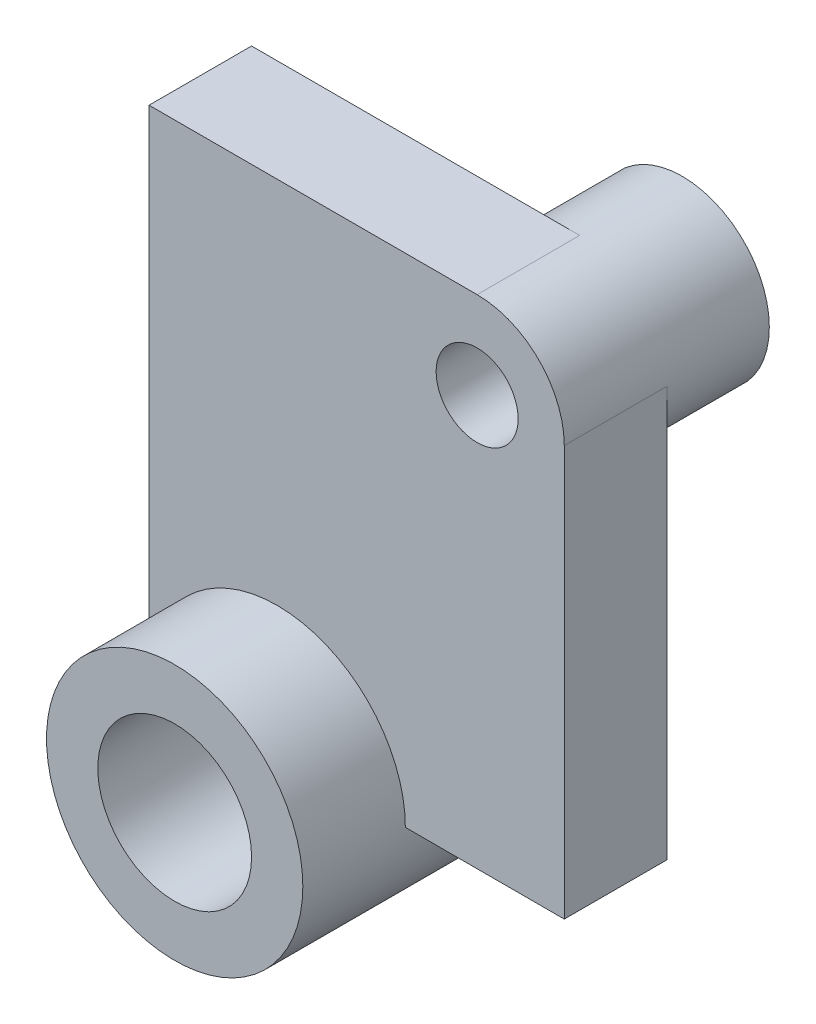
from build123d import *
from build123d.topology import SkipClean

# Parameters (mm, degrees)
SKETCH_1_R          = 4
EXTRUDE_1_DEPTH     = 10
CUT_EXTRUDE_1_DEPTH = 63.713634881
SKETCH_3_R          = 12.5
EXTRUDE_2_DEPTH     = 10
CUT_EXTRUDE_2_REACH = 64.292
SKETCH_4_R          = 7.5
EXTRUDE_START       = 10
SKETCH_5_R          = 12.5
SKETCH_5_R_2        = 7.5
EXTRUDE_3_DEPTH     = 10
SKETCH_6_R          = 8.5
SKETCH_6_R_2        = 4
EXTRUDE_4_DEPTH     = 10
EXTRUDE_START_2     = -10
EXTRUDE_5_DEPTH     = 10
CUT_EXTRUDE_3_DEPTH = 65.654852873


with BuildPart() as part:
    # Эскиз1 → Бобышка-Вытянуть1 (new body)
    with BuildSketch(Plane.XY):
        with BuildLine():
            Line((13, -15), (8.188495856, 2.280029742))
            ThreePointArc((8.188495856, 2.280029742), (2.584908604, 8.097422276), (-5.352868863, 6.602786907))
            Line((-5.352868863, 6.602786907), (-32, -15))
            Line((-32, -15), (-32, -40))
            Line((-32, -40), (-13, -40))
            ThreePointArc((-13, -40), (0, -53), (13, -40))
            Line((13, -40), (13, -15))
        make_face()
        Circle(SKETCH_1_R, mode=Mode.SUBTRACT)
    extrude(amount=EXTRUDE_1_DEPTH)

    # Эскиз2 → Вырез-Вытянуть1 (cut, through all)
    with BuildSketch(Plane.XY.offset(10)):
        with BuildLine():
            Line((-13, -40), (13, -40))
            ThreePointArc((13, -40), (0, -53), (-13, -40))
        make_face()
    extrude(amount=-CUT_EXTRUDE_1_DEPTH, mode=Mode.SUBTRACT)

    # Эскиз3 → Бобышка-Вытянуть2 (add)
    with BuildSketch(Plane.XY.offset(10)):
        with Locations((-19.5, -40)):
            Circle(SKETCH_3_R)
    extrude(amount=-EXTRUDE_2_DEPTH)

    # Эскиз4 → Вырез-Вытянуть2 (cut, up to next)
    with BuildSketch(Plane.XY.offset(10), mode=Mode.PRIVATE) as cut_extrude_2_sk1:
        with Locations((-19.5, -40)):
            Circle(SKETCH_4_R)
    cut_extrude_2_tool1 = extrude(cut_extrude_2_sk1.sketch, amount=-CUT_EXTRUDE_2_REACH, mode=Mode.PRIVATE) & part.part
    add(cut_extrude_2_tool1.solids().sort_by_distance((-19.5, -40, 10))[0], mode=Mode.SUBTRACT)

    # Эскиз5 → Бобышка-Вытянуть3 (add)
    with BuildSketch(Plane.XY.offset(10).offset(EXTRUDE_START)):
        with Locations((-19.5, -40)):
            Circle(SKETCH_5_R)
        with Locations((-19.5, -40)):
            Circle(SKETCH_5_R_2, mode=Mode.SUBTRACT)
    extrude(amount=-EXTRUDE_3_DEPTH)

    # Эскиз6 → Бобышка-Вытянуть4 (add)
    with SkipClean():  # the faces are left unmerged after this step: merging them gives an invalid solid
        with BuildSketch(Plane(origin=(0, 0, 0), x_dir=(-1, 0, 0), z_dir=(0, 0, -1)).offset(EXTRUDE_START)):
            Circle(SKETCH_6_R)
            Circle(SKETCH_6_R_2, mode=Mode.SUBTRACT)
        extrude(amount=-EXTRUDE_4_DEPTH)

    # Эскиз7 → Бобышка-Вытянуть5 (add)
    with SkipClean():  # the faces are left unmerged after this step: merging them gives an invalid solid
        with BuildSketch(Plane.XY.offset(10).offset(EXTRUDE_START_2)):
            with BuildLine():
                Line((-32, 8.5), (-32, -15))
                Line((-32, -15), (-5.352868863, 6.602786907))
                ThreePointArc((-5.352868863, 6.602786907), (-2.839569604, 8.011669268), (4e-08, 8.5))
                Line((4e-08, 8.5), (-32, 8.5))
            make_face()
            with BuildLine():
                Line((13, 8.5), (4e-08, 8.5))
                ThreePointArc((4e-08, 8.5), (5.14148556, 6.768687187), (8.188495856, 2.280029742))
                Line((8.188495856, 2.280029742), (13, -15))
                Line((13, -15), (13, 8.5))
            make_face()
        extrude(amount=EXTRUDE_5_DEPTH)
    add(part.part.scale(1), mode=Mode.REPLACE)  # the faces are merged on a copy

    # Эскиз8 → Вырез-Вытянуть3 (cut, through all)
    with BuildSketch(Plane(origin=(0, 0, 0), x_dir=(-1, 0, 0), z_dir=(0, 0, -1))):
        with BuildLine():
            Line((-8.5, -40), (-8.5, 0))
            ThreePointArc((-8.5, 0), (-6.01040764, 6.01040764), (0, 8.5))
            Line((0, 8.5), (-13, 8.5))
            Line((-13, 8.5), (-13, -40))
            Line((-13, -40), (-8.5, -40))
        make_face()
    extrude(amount=-CUT_EXTRUDE_3_DEPTH, mode=Mode.SUBTRACT)


solid = part.part
